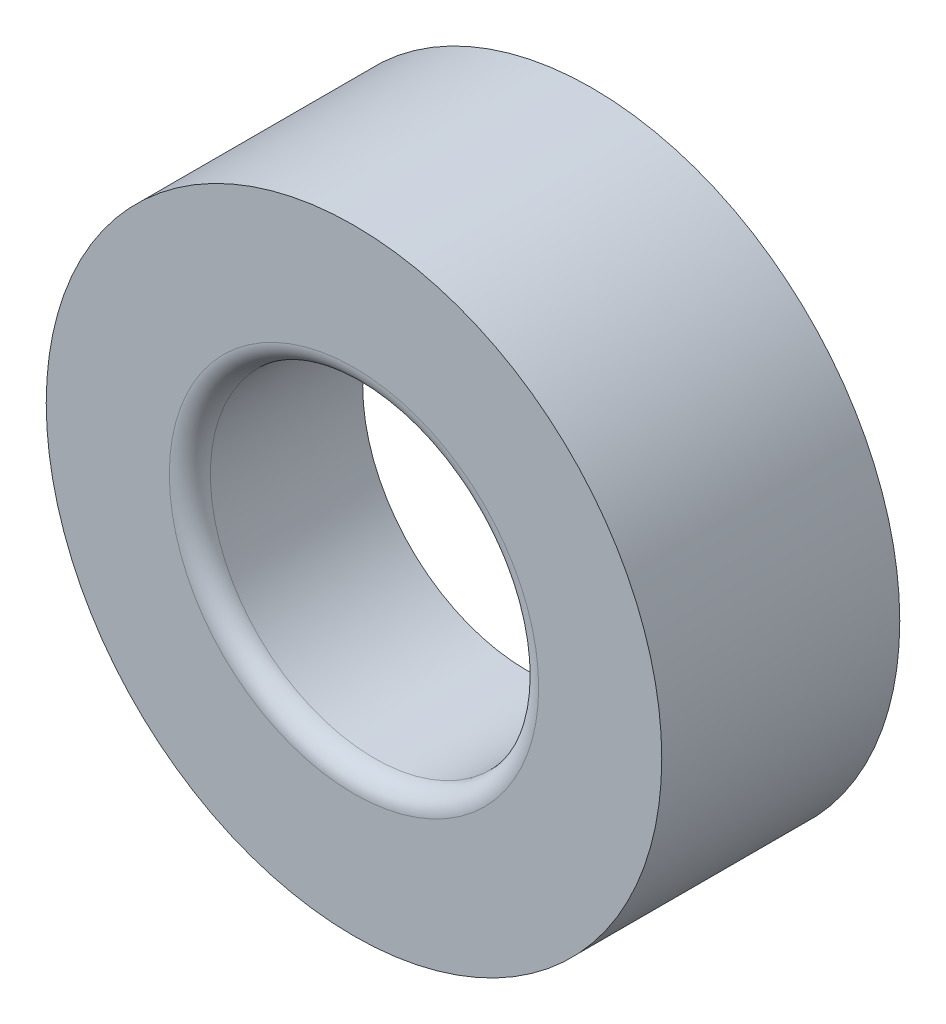
from build123d import *

# Parameters (mm, degrees)
SKETCH1_R           = 7.5
BOSS_EXTRUDE1_DEPTH = 5.8
SKETCH2_R           = 4
CUT_EXTRUDE1_DEPTH  = 94.348604063
SKETCH3_R           = 6.3
CUT_EXTRUDE2_DEPTH  = 1.5875
FILLET1_R           = 0.5


with BuildPart() as part:
    # Sketch1 → Boss-Extrude1 (new body)
    with BuildSketch(Plane.XY):
        with Locations((85.206527413, -1.763997815)):
            Circle(SKETCH1_R)
    extrude(amount=BOSS_EXTRUDE1_DEPTH)

    # Sketch2 → Cut-Extrude1 (cut, through all)
    with BuildSketch(Plane.XY.offset(5.8)):
        with Locations((85.206527413, -1.763997815)):
            Circle(SKETCH2_R)
    extrude(amount=-CUT_EXTRUDE1_DEPTH, mode=Mode.SUBTRACT)

    # Sketch3 → Cut-Extrude2 (cut)
    with BuildSketch(Plane(origin=(0, 0, 0), x_dir=(-1, 0, 0), z_dir=(0, 0, -1))):
        with Locations((-85.206527413, -1.763997815)):
            Circle(SKETCH3_R)
    extrude(amount=-CUT_EXTRUDE2_DEPTH, mode=Mode.SUBTRACT)

    # Fillet1
    fillet1_edges = [part.edges().sort_by_distance(p)[0] for p in [
        (81.206527413, -1.763997815, 5.8),
    ]]
    fillet(fillet1_edges, radius=FILLET1_R)


solid = part.part
